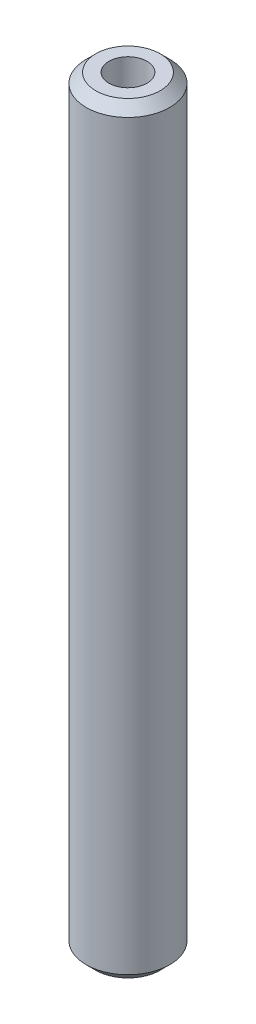
from build123d import *

# Parameters (mm, degrees)
SKETCH1_R           = 10
BOSS_EXTRUDE1_DEPTH = 182.31194977
SKETCH2_R           = 4.557136244
CUT_EXTRUDE1_DEPTH  = 183.859637506
CHAMFER1_SIZE       = 2.307814367


with BuildPart() as part:
    # Sketch1 → Boss-Extrude1 (new body)
    with BuildSketch(Plane(origin=(0, 0, 0), x_dir=(1, 0, 0), z_dir=(0, 1, 0))):
        Circle(SKETCH1_R)
    extrude(amount=BOSS_EXTRUDE1_DEPTH)

    # Sketch2 → Cut-Extrude1 (cut, through all)
    with BuildSketch(Plane(origin=(0, 0, 0), x_dir=(1, 0, 0), z_dir=(0, 1, 0))):
        Circle(SKETCH2_R)
    extrude(amount=CUT_EXTRUDE1_DEPTH, mode=Mode.SUBTRACT)

    # Chamfer1
    chamfer1_edges = [part.edges().sort_by_distance(p)[0] for p in [
        (-10, 182.31194977, 0),
        (-10, 0, 0),
    ]]
    chamfer(chamfer1_edges, length=CHAMFER1_SIZE)


solid = part.part
